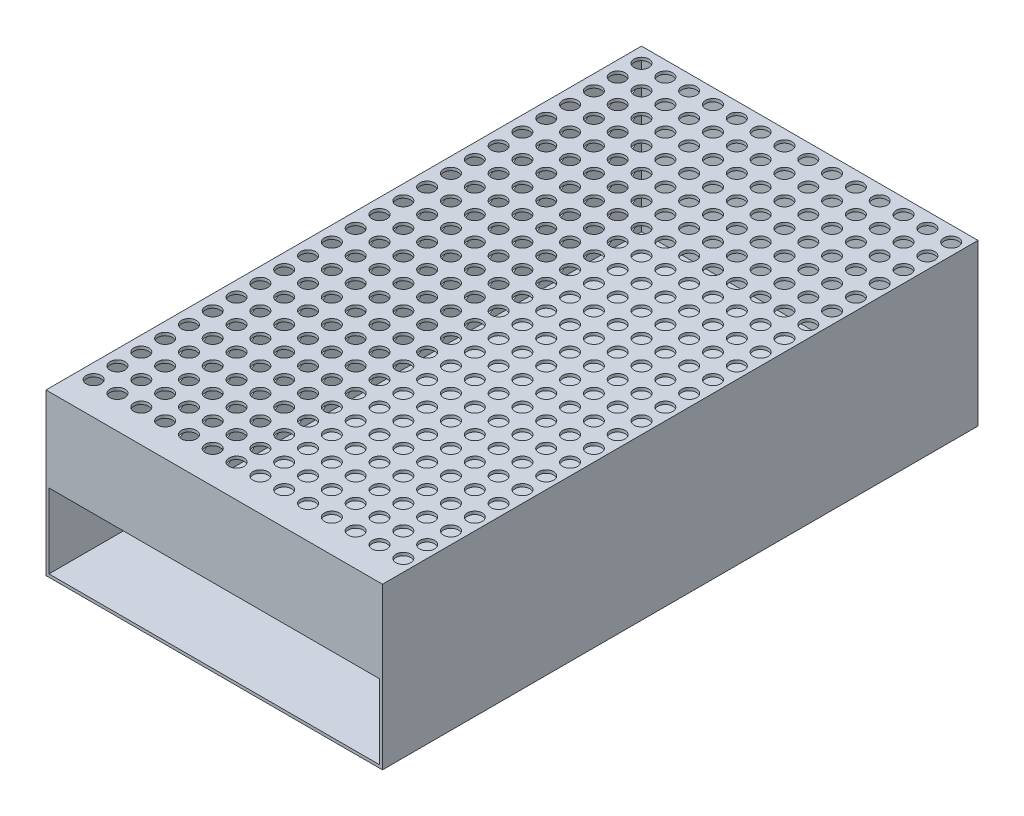
from build123d import *

# Parameters (mm, degrees)
SKETCH1_W           = 113
SKETCH1_H           = 200
BOSS_EXTRUDE1_DEPTH = 54
SKETCH3_W           = 111
SKETCH3_H           = 52
CUT_EXTRUDE1_DEPTH  = 199
SKETCH4_R           = 2.5
CUT_EXTRUDE2_DEPTH  = 65
SKETCH5_R           = 2.5
CUT_EXTRUDE3_DEPTH  = 37
SKETCH6_W           = 113
SKETCH6_H           = 1
BOSS_EXTRUDE2_DEPTH = 27


with BuildPart() as part:
    # Sketch1 → Boss-Extrude1 (new body)
    with BuildSketch(Plane(origin=(0, 0, 0), x_dir=(1, 0, 0), z_dir=(0, 1, 0))):
        Rectangle(SKETCH1_W, SKETCH1_H)
    extrude(amount=BOSS_EXTRUDE1_DEPTH)

    # Sketch3 → Cut-Extrude1 (cut)
    with BuildSketch(Plane.XY.offset(100)):
        with Locations((0, 27)):
            Rectangle(SKETCH3_W, SKETCH3_H)
    extrude(amount=-CUT_EXTRUDE1_DEPTH, mode=Mode.SUBTRACT)

    # Sketch4 → Cut-Extrude2 (cut)
    with BuildSketch(Plane.ZY.offset(56.5)):
        with Locations((-95, 5)):
            Circle(SKETCH4_R)
        with Locations((-87, 5)):
            Circle(SKETCH4_R)
        with Locations((-79, 5)):
            Circle(SKETCH4_R)
        with Locations((-71, 5)):
            Circle(SKETCH4_R)
        with Locations((-63, 5)):
            Circle(SKETCH4_R)
        with Locations((-55, 5)):
            Circle(SKETCH4_R)
        with Locations((-47, 5)):
            Circle(SKETCH4_R)
        with Locations((-39, 5)):
            Circle(SKETCH4_R)
        with Locations((-31, 5)):
            Circle(SKETCH4_R)
        with Locations((-23, 5)):
            Circle(SKETCH4_R)
        with Locations((-15, 5)):
            Circle(SKETCH4_R)
        with Locations((-7, 5)):
            Circle(SKETCH4_R)
        with Locations((1, 5)):
            Circle(SKETCH4_R)
        with Locations((9, 5)):
            Circle(SKETCH4_R)
        with Locations((17, 5)):
            Circle(SKETCH4_R)
        with Locations((25, 5)):
            Circle(SKETCH4_R)
        with Locations((33, 5)):
            Circle(SKETCH4_R)
        with Locations((41, 5)):
            Circle(SKETCH4_R)
        with Locations((49, 5)):
            Circle(SKETCH4_R)
        with Locations((57, 5)):
            Circle(SKETCH4_R)
        with Locations((-87, 13)):
            Circle(SKETCH4_R)
        with Locations((-79, 13)):
            Circle(SKETCH4_R)
        with Locations((-71, 13)):
            Circle(SKETCH4_R)
        with Locations((-63, 13)):
            Circle(SKETCH4_R)
        with Locations((-55, 13)):
            Circle(SKETCH4_R)
        with Locations((-47, 13)):
            Circle(SKETCH4_R)
        with Locations((-39, 13)):
            Circle(SKETCH4_R)
        with Locations((-31, 13)):
            Circle(SKETCH4_R)
        with Locations((-23, 13)):
            Circle(SKETCH4_R)
        with Locations((-15, 13)):
            Circle(SKETCH4_R)
        with Locations((-7, 13)):
            Circle(SKETCH4_R)
        with Locations((1, 13)):
            Circle(SKETCH4_R)
        with Locations((9, 13)):
            Circle(SKETCH4_R)
        with Locations((17, 13)):
            Circle(SKETCH4_R)
        with Locations((25, 13)):
            Circle(SKETCH4_R)
        with Locations((33, 13)):
            Circle(SKETCH4_R)
        with Locations((41, 13)):
            Circle(SKETCH4_R)
        with Locations((49, 13)):
            Circle(SKETCH4_R)
        with Locations((57, 13)):
            Circle(SKETCH4_R)
        with Locations((-87, 21)):
            Circle(SKETCH4_R)
        with Locations((-79, 21)):
            Circle(SKETCH4_R)
        with Locations((-71, 21)):
            Circle(SKETCH4_R)
        with Locations((-63, 21)):
            Circle(SKETCH4_R)
        with Locations((-55, 21)):
            Circle(SKETCH4_R)
        with Locations((-47, 21)):
            Circle(SKETCH4_R)
        with Locations((-39, 21)):
            Circle(SKETCH4_R)
        with Locations((-31, 21)):
            Circle(SKETCH4_R)
        with Locations((-23, 21)):
            Circle(SKETCH4_R)
        with Locations((-15, 21)):
            Circle(SKETCH4_R)
        with Locations((-7, 21)):
            Circle(SKETCH4_R)
        with Locations((1, 21)):
            Circle(SKETCH4_R)
        with Locations((9, 21)):
            Circle(SKETCH4_R)
        with Locations((17, 21)):
            Circle(SKETCH4_R)
        with Locations((25, 21)):
            Circle(SKETCH4_R)
        with Locations((33, 21)):
            Circle(SKETCH4_R)
        with Locations((41, 21)):
            Circle(SKETCH4_R)
        with Locations((49, 21)):
            Circle(SKETCH4_R)
        with Locations((57, 21)):
            Circle(SKETCH4_R)
        with Locations((-87, 29)):
            Circle(SKETCH4_R)
        with Locations((-79, 29)):
            Circle(SKETCH4_R)
        with Locations((-71, 29)):
            Circle(SKETCH4_R)
        with Locations((-63, 29)):
            Circle(SKETCH4_R)
        with Locations((-55, 29)):
            Circle(SKETCH4_R)
        with Locations((-47, 29)):
            Circle(SKETCH4_R)
        with Locations((-39, 29)):
            Circle(SKETCH4_R)
        with Locations((-31, 29)):
            Circle(SKETCH4_R)
        with Locations((-23, 29)):
            Circle(SKETCH4_R)
        with Locations((-15, 29)):
            Circle(SKETCH4_R)
        with Locations((-7, 29)):
            Circle(SKETCH4_R)
        with Locations((1, 29)):
            Circle(SKETCH4_R)
        with Locations((9, 29)):
            Circle(SKETCH4_R)
        with Locations((17, 29)):
            Circle(SKETCH4_R)
        with Locations((25, 29)):
            Circle(SKETCH4_R)
        with Locations((33, 29)):
            Circle(SKETCH4_R)
        with Locations((41, 29)):
            Circle(SKETCH4_R)
        with Locations((49, 29)):
            Circle(SKETCH4_R)
        with Locations((57, 29)):
            Circle(SKETCH4_R)
        with Locations((-87, 37)):
            Circle(SKETCH4_R)
        with Locations((-79, 37)):
            Circle(SKETCH4_R)
        with Locations((-71, 37)):
            Circle(SKETCH4_R)
        with Locations((-63, 37)):
            Circle(SKETCH4_R)
        with Locations((-55, 37)):
            Circle(SKETCH4_R)
        with Locations((-47, 37)):
            Circle(SKETCH4_R)
        with Locations((-39, 37)):
            Circle(SKETCH4_R)
        with Locations((-31, 37)):
            Circle(SKETCH4_R)
        with Locations((-23, 37)):
            Circle(SKETCH4_R)
        with Locations((-15, 37)):
            Circle(SKETCH4_R)
        with Locations((-7, 37)):
            Circle(SKETCH4_R)
        with Locations((1, 37)):
            Circle(SKETCH4_R)
        with Locations((9, 37)):
            Circle(SKETCH4_R)
        with Locations((17, 37)):
            Circle(SKETCH4_R)
        with Locations((25, 37)):
            Circle(SKETCH4_R)
        with Locations((33, 37)):
            Circle(SKETCH4_R)
        with Locations((41, 37)):
            Circle(SKETCH4_R)
        with Locations((49, 37)):
            Circle(SKETCH4_R)
        with Locations((57, 37)):
            Circle(SKETCH4_R)
        with Locations((-87, 45)):
            Circle(SKETCH4_R)
        with Locations((-79, 45)):
            Circle(SKETCH4_R)
        with Locations((-71, 45)):
            Circle(SKETCH4_R)
        with Locations((-63, 45)):
            Circle(SKETCH4_R)
        with Locations((-55, 45)):
            Circle(SKETCH4_R)
        with Locations((-47, 45)):
            Circle(SKETCH4_R)
        with Locations((-39, 45)):
            Circle(SKETCH4_R)
        with Locations((-31, 45)):
            Circle(SKETCH4_R)
        with Locations((-23, 45)):
            Circle(SKETCH4_R)
        with Locations((-15, 45)):
            Circle(SKETCH4_R)
        with Locations((-7, 45)):
            Circle(SKETCH4_R)
        with Locations((1, 45)):
            Circle(SKETCH4_R)
        with Locations((9, 45)):
            Circle(SKETCH4_R)
        with Locations((17, 45)):
            Circle(SKETCH4_R)
        with Locations((25, 45)):
            Circle(SKETCH4_R)
        with Locations((33, 45)):
            Circle(SKETCH4_R)
        with Locations((41, 45)):
            Circle(SKETCH4_R)
        with Locations((49, 45)):
            Circle(SKETCH4_R)
        with Locations((57, 45)):
            Circle(SKETCH4_R)
        with Locations((-95, 13)):
            Circle(SKETCH4_R)
        with Locations((-95, 21)):
            Circle(SKETCH4_R)
        with Locations((-95, 29)):
            Circle(SKETCH4_R)
        with Locations((-95, 37)):
            Circle(SKETCH4_R)
        with Locations((-95, 45)):
            Circle(SKETCH4_R)
    extrude(amount=-CUT_EXTRUDE2_DEPTH, mode=Mode.SUBTRACT)

    # Sketch5 → Cut-Extrude3 (cut)
    with BuildSketch(Plane(origin=(0, 54, 0), x_dir=(1, 0, 0), z_dir=(0, 1, 0))):
        with Locations(Location((-51.5, 95, 0), (0, 0, 270))):
            Circle(SKETCH5_R)
        with Locations(Location((-43.5, 95, 0), (0, 0, 270))):
            Circle(SKETCH5_R)
        with Locations(Location((-35.5, 95, 0), (0, 0, 270))):
            Circle(SKETCH5_R)
        with Locations(Location((-27.5, 95, 0), (0, 0, 270))):
            Circle(SKETCH5_R)
        with Locations(Location((-19.5, 95, 0), (0, 0, 270))):
            Circle(SKETCH5_R)
        with Locations(Location((-11.5, 95, 0), (0, 0, 270))):
            Circle(SKETCH5_R)
        with Locations(Location((-3.5, 95, 0), (0, 0, 270))):
            Circle(SKETCH5_R)
        with Locations(Location((4.5, 95, 0), (0, 0, 270))):
            Circle(SKETCH5_R)
        with Locations(Location((12.5, 95, 0), (0, 0, 270))):
            Circle(SKETCH5_R)
        with Locations(Location((20.5, 95, 0), (0, 0, 270))):
            Circle(SKETCH5_R)
        with Locations(Location((28.5, 95, 0), (0, 0, 270))):
            Circle(SKETCH5_R)
        with Locations(Location((36.5, 95, 0), (0, 0, 270))):
            Circle(SKETCH5_R)
        with Locations(Location((44.5, 95, 0), (0, 0, 270))):
            Circle(SKETCH5_R)
        with Locations(Location((52.5, 95, 0), (0, 0, 270))):
            Circle(SKETCH5_R)
        with Locations(Location((-43.5, 87, 0), (0, 0, 270))):
            Circle(SKETCH5_R)
        with Locations(Location((-35.5, 87, 0), (0, 0, 270))):
            Circle(SKETCH5_R)
        with Locations(Location((-27.5, 87, 0), (0, 0, 270))):
            Circle(SKETCH5_R)
        with Locations(Location((-19.5, 87, 0), (0, 0, 270))):
            Circle(SKETCH5_R)
        with Locations(Location((-11.5, 87, 0), (0, 0, 270))):
            Circle(SKETCH5_R)
        with Locations(Location((-3.5, 87, 0), (0, 0, 270))):
            Circle(SKETCH5_R)
        with Locations(Location((4.5, 87, 0), (0, 0, 270))):
            Circle(SKETCH5_R)
        with Locations(Location((12.5, 87, 0), (0, 0, 270))):
            Circle(SKETCH5_R)
        with Locations(Location((20.5, 87, 0), (0, 0, 270))):
            Circle(SKETCH5_R)
        with Locations(Location((28.5, 87, 0), (0, 0, 270))):
            Circle(SKETCH5_R)
        with Locations(Location((36.5, 87, 0), (0, 0, 270))):
            Circle(SKETCH5_R)
        with Locations(Location((44.5, 87, 0), (0, 0, 270))):
            Circle(SKETCH5_R)
        with Locations(Location((52.5, 87, 0), (0, 0, 270))):
            Circle(SKETCH5_R)
        with Locations(Location((-43.5, 79, 0), (0, 0, 270))):
            Circle(SKETCH5_R)
        with Locations(Location((-35.5, 79, 0), (0, 0, 270))):
            Circle(SKETCH5_R)
        with Locations(Location((-27.5, 79, 0), (0, 0, 270))):
            Circle(SKETCH5_R)
        with Locations(Location((-19.5, 79, 0), (0, 0, 270))):
            Circle(SKETCH5_R)
        with Locations(Location((-11.5, 79, 0), (0, 0, 270))):
            Circle(SKETCH5_R)
        with Locations(Location((-3.5, 79, 0), (0, 0, 270))):
            Circle(SKETCH5_R)
        with Locations(Location((4.5, 79, 0), (0, 0, 270))):
            Circle(SKETCH5_R)
        with Locations(Location((12.5, 79, 0), (0, 0, 270))):
            Circle(SKETCH5_R)
        with Locations(Location((20.5, 79, 0), (0, 0, 270))):
            Circle(SKETCH5_R)
        with Locations(Location((28.5, 79, 0), (0, 0, 270))):
            Circle(SKETCH5_R)
        with Locations(Location((36.5, 79, 0), (0, 0, 270))):
            Circle(SKETCH5_R)
        with Locations(Location((44.5, 79, 0), (0, 0, 270))):
            Circle(SKETCH5_R)
        with Locations(Location((52.5, 79, 0), (0, 0, 270))):
            Circle(SKETCH5_R)
        with Locations(Location((-43.5, 71, 0), (0, 0, 270))):
            Circle(SKETCH5_R)
        with Locations(Location((-35.5, 71, 0), (0, 0, 270))):
            Circle(SKETCH5_R)
        with Locations(Location((-27.5, 71, 0), (0, 0, 270))):
            Circle(SKETCH5_R)
        with Locations(Location((-19.5, 71, 0), (0, 0, 270))):
            Circle(SKETCH5_R)
        with Locations(Location((-11.5, 71, 0), (0, 0, 270))):
            Circle(SKETCH5_R)
        with Locations(Location((-3.5, 71, 0), (0, 0, 270))):
            Circle(SKETCH5_R)
        with Locations(Location((4.5, 71, 0), (0, 0, 270))):
            Circle(SKETCH5_R)
        with Locations(Location((12.5, 71, 0), (0, 0, 270))):
            Circle(SKETCH5_R)
        with Locations(Location((20.5, 71, 0), (0, 0, 270))):
            Circle(SKETCH5_R)
        with Locations(Location((28.5, 71, 0), (0, 0, 270))):
            Circle(SKETCH5_R)
        with Locations(Location((36.5, 71, 0), (0, 0, 270))):
            Circle(SKETCH5_R)
        with Locations(Location((44.5, 71, 0), (0, 0, 270))):
            Circle(SKETCH5_R)
        with Locations(Location((52.5, 71, 0), (0, 0, 270))):
            Circle(SKETCH5_R)
        with Locations(Location((-43.5, 63, 0), (0, 0, 270))):
            Circle(SKETCH5_R)
        with Locations(Location((-35.5, 63, 0), (0, 0, 270))):
            Circle(SKETCH5_R)
        with Locations(Location((-27.5, 63, 0), (0, 0, 270))):
            Circle(SKETCH5_R)
        with Locations(Location((-19.5, 63, 0), (0, 0, 270))):
            Circle(SKETCH5_R)
        with Locations(Location((-11.5, 63, 0), (0, 0, 270))):
            Circle(SKETCH5_R)
        with Locations(Location((-3.5, 63, 0), (0, 0, 270))):
            Circle(SKETCH5_R)
        with Locations(Location((4.5, 63, 0), (0, 0, 270))):
            Circle(SKETCH5_R)
        with Locations(Location((12.5, 63, 0), (0, 0, 270))):
            Circle(SKETCH5_R)
        with Locations(Location((20.5, 63, 0), (0, 0, 270))):
            Circle(SKETCH5_R)
        with Locations(Location((28.5, 63, 0), (0, 0, 270))):
            Circle(SKETCH5_R)
        with Locations(Location((36.5, 63, 0), (0, 0, 270))):
            Circle(SKETCH5_R)
        with Locations(Location((44.5, 63, 0), (0, 0, 270))):
            Circle(SKETCH5_R)
        with Locations(Location((52.5, 63, 0), (0, 0, 270))):
            Circle(SKETCH5_R)
        with Locations(Location((-43.5, 55, 0), (0, 0, 270))):
            Circle(SKETCH5_R)
        with Locations(Location((-35.5, 55, 0), (0, 0, 270))):
            Circle(SKETCH5_R)
        with Locations(Location((-27.5, 55, 0), (0, 0, 270))):
            Circle(SKETCH5_R)
        with Locations(Location((-19.5, 55, 0), (0, 0, 270))):
            Circle(SKETCH5_R)
        with Locations(Location((-11.5, 55, 0), (0, 0, 270))):
            Circle(SKETCH5_R)
        with Locations(Location((-3.5, 55, 0), (0, 0, 270))):
            Circle(SKETCH5_R)
        with Locations(Location((4.5, 55, 0), (0, 0, 270))):
            Circle(SKETCH5_R)
        with Locations(Location((12.5, 55, 0), (0, 0, 270))):
            Circle(SKETCH5_R)
        with Locations(Location((20.5, 55, 0), (0, 0, 270))):
            Circle(SKETCH5_R)
        with Locations(Location((28.5, 55, 0), (0, 0, 270))):
            Circle(SKETCH5_R)
        with Locations(Location((36.5, 55, 0), (0, 0, 270))):
            Circle(SKETCH5_R)
        with Locations(Location((44.5, 55, 0), (0, 0, 270))):
            Circle(SKETCH5_R)
        with Locations(Location((52.5, 55, 0), (0, 0, 270))):
            Circle(SKETCH5_R)
        with Locations(Location((-43.5, 47, 0), (0, 0, 270))):
            Circle(SKETCH5_R)
        with Locations(Location((-35.5, 47, 0), (0, 0, 270))):
            Circle(SKETCH5_R)
        with Locations(Location((-27.5, 47, 0), (0, 0, 270))):
            Circle(SKETCH5_R)
        with Locations(Location((-19.5, 47, 0), (0, 0, 270))):
            Circle(SKETCH5_R)
        with Locations(Location((-11.5, 47, 0), (0, 0, 270))):
            Circle(SKETCH5_R)
        with Locations(Location((-3.5, 47, 0), (0, 0, 270))):
            Circle(SKETCH5_R)
        with Locations(Location((4.5, 47, 0), (0, 0, 270))):
            Circle(SKETCH5_R)
        with Locations(Location((12.5, 47, 0), (0, 0, 270))):
            Circle(SKETCH5_R)
        with Locations(Location((20.5, 47, 0), (0, 0, 270))):
            Circle(SKETCH5_R)
        with Locations(Location((28.5, 47, 0), (0, 0, 270))):
            Circle(SKETCH5_R)
        with Locations(Location((36.5, 47, 0), (0, 0, 270))):
            Circle(SKETCH5_R)
        with Locations(Location((44.5, 47, 0), (0, 0, 270))):
            Circle(SKETCH5_R)
        with Locations(Location((52.5, 47, 0), (0, 0, 270))):
            Circle(SKETCH5_R)
        with Locations(Location((-43.5, 39, 0), (0, 0, 270))):
            Circle(SKETCH5_R)
        with Locations(Location((-35.5, 39, 0), (0, 0, 270))):
            Circle(SKETCH5_R)
        with Locations(Location((-27.5, 39, 0), (0, 0, 270))):
            Circle(SKETCH5_R)
        with Locations(Location((-19.5, 39, 0), (0, 0, 270))):
            Circle(SKETCH5_R)
        with Locations(Location((-11.5, 39, 0), (0, 0, 270))):
            Circle(SKETCH5_R)
        with Locations(Location((-3.5, 39, 0), (0, 0, 270))):
            Circle(SKETCH5_R)
        with Locations(Location((4.5, 39, 0), (0, 0, 270))):
            Circle(SKETCH5_R)
        with Locations(Location((12.5, 39, 0), (0, 0, 270))):
            Circle(SKETCH5_R)
        with Locations(Location((20.5, 39, 0), (0, 0, 270))):
            Circle(SKETCH5_R)
        with Locations(Location((28.5, 39, 0), (0, 0, 270))):
            Circle(SKETCH5_R)
        with Locations(Location((36.5, 39, 0), (0, 0, 270))):
            Circle(SKETCH5_R)
        with Locations(Location((44.5, 39, 0), (0, 0, 270))):
            Circle(SKETCH5_R)
        with Locations(Location((52.5, 39, 0), (0, 0, 270))):
            Circle(SKETCH5_R)
        with Locations(Location((-43.5, 31, 0), (0, 0, 270))):
            Circle(SKETCH5_R)
        with Locations(Location((-35.5, 31, 0), (0, 0, 270))):
            Circle(SKETCH5_R)
        with Locations(Location((-27.5, 31, 0), (0, 0, 270))):
            Circle(SKETCH5_R)
        with Locations(Location((-19.5, 31, 0), (0, 0, 270))):
            Circle(SKETCH5_R)
        with Locations(Location((-11.5, 31, 0), (0, 0, 270))):
            Circle(SKETCH5_R)
        with Locations(Location((-3.5, 31, 0), (0, 0, 270))):
            Circle(SKETCH5_R)
        with Locations(Location((4.5, 31, 0), (0, 0, 270))):
            Circle(SKETCH5_R)
        with Locations(Location((12.5, 31, 0), (0, 0, 270))):
            Circle(SKETCH5_R)
        with Locations(Location((20.5, 31, 0), (0, 0, 270))):
            Circle(SKETCH5_R)
        with Locations(Location((28.5, 31, 0), (0, 0, 270))):
            Circle(SKETCH5_R)
        with Locations(Location((36.5, 31, 0), (0, 0, 270))):
            Circle(SKETCH5_R)
        with Locations(Location((44.5, 31, 0), (0, 0, 270))):
            Circle(SKETCH5_R)
        with Locations(Location((52.5, 31, 0), (0, 0, 270))):
            Circle(SKETCH5_R)
        with Locations(Location((-43.5, 23, 0), (0, 0, 270))):
            Circle(SKETCH5_R)
        with Locations(Location((-35.5, 23, 0), (0, 0, 270))):
            Circle(SKETCH5_R)
        with Locations(Location((-27.5, 23, 0), (0, 0, 270))):
            Circle(SKETCH5_R)
        with Locations(Location((-19.5, 23, 0), (0, 0, 270))):
            Circle(SKETCH5_R)
        with Locations(Location((-11.5, 23, 0), (0, 0, 270))):
            Circle(SKETCH5_R)
        with Locations(Location((-3.5, 23, 0), (0, 0, 270))):
            Circle(SKETCH5_R)
        with Locations(Location((4.5, 23, 0), (0, 0, 270))):
            Circle(SKETCH5_R)
        with Locations(Location((12.5, 23, 0), (0, 0, 270))):
            Circle(SKETCH5_R)
        with Locations(Location((20.5, 23, 0), (0, 0, 270))):
            Circle(SKETCH5_R)
        with Locations(Location((28.5, 23, 0), (0, 0, 270))):
            Circle(SKETCH5_R)
        with Locations(Location((36.5, 23, 0), (0, 0, 270))):
            Circle(SKETCH5_R)
        with Locations(Location((44.5, 23, 0), (0, 0, 270))):
            Circle(SKETCH5_R)
        with Locations(Location((52.5, 23, 0), (0, 0, 270))):
            Circle(SKETCH5_R)
        with Locations(Location((-43.5, 15, 0), (0, 0, 270))):
            Circle(SKETCH5_R)
        with Locations(Location((-35.5, 15, 0), (0, 0, 270))):
            Circle(SKETCH5_R)
        with Locations(Location((-27.5, 15, 0), (0, 0, 270))):
            Circle(SKETCH5_R)
        with Locations(Location((-19.5, 15, 0), (0, 0, 270))):
            Circle(SKETCH5_R)
        with Locations(Location((-11.5, 15, 0), (0, 0, 270))):
            Circle(SKETCH5_R)
        with Locations(Location((-3.5, 15, 0), (0, 0, 270))):
            Circle(SKETCH5_R)
        with Locations(Location((4.5, 15, 0), (0, 0, 270))):
            Circle(SKETCH5_R)
        with Locations(Location((12.5, 15, 0), (0, 0, 270))):
            Circle(SKETCH5_R)
        with Locations(Location((20.5, 15, 0), (0, 0, 270))):
            Circle(SKETCH5_R)
        with Locations(Location((28.5, 15, 0), (0, 0, 270))):
            Circle(SKETCH5_R)
        with Locations(Location((36.5, 15, 0), (0, 0, 270))):
            Circle(SKETCH5_R)
        with Locations(Location((44.5, 15, 0), (0, 0, 270))):
            Circle(SKETCH5_R)
        with Locations(Location((52.5, 15, 0), (0, 0, 270))):
            Circle(SKETCH5_R)
        with Locations(Location((-43.5, 7, 0), (0, 0, 270))):
            Circle(SKETCH5_R)
        with Locations(Location((-35.5, 7, 0), (0, 0, 270))):
            Circle(SKETCH5_R)
        with Locations(Location((-27.5, 7, 0), (0, 0, 270))):
            Circle(SKETCH5_R)
        with Locations(Location((-19.5, 7, 0), (0, 0, 270))):
            Circle(SKETCH5_R)
        with Locations(Location((-11.5, 7, 0), (0, 0, 270))):
            Circle(SKETCH5_R)
        with Locations(Location((-3.5, 7, 0), (0, 0, 270))):
            Circle(SKETCH5_R)
        with Locations(Location((4.5, 7, 0), (0, 0, 270))):
            Circle(SKETCH5_R)
        with Locations(Location((12.5, 7, 0), (0, 0, 270))):
            Circle(SKETCH5_R)
        with Locations(Location((20.5, 7, 0), (0, 0, 270))):
            Circle(SKETCH5_R)
        with Locations(Location((28.5, 7, 0), (0, 0, 270))):
            Circle(SKETCH5_R)
        with Locations(Location((36.5, 7, 0), (0, 0, 270))):
            Circle(SKETCH5_R)
        with Locations(Location((44.5, 7, 0), (0, 0, 270))):
            Circle(SKETCH5_R)
        with Locations(Location((52.5, 7, 0), (0, 0, 270))):
            Circle(SKETCH5_R)
        with Locations(Location((-43.5, -1, 0), (0, 0, 270))):
            Circle(SKETCH5_R)
        with Locations(Location((-35.5, -1, 0), (0, 0, 270))):
            Circle(SKETCH5_R)
        with Locations(Location((-27.5, -1, 0), (0, 0, 270))):
            Circle(SKETCH5_R)
        with Locations(Location((-19.5, -1, 0), (0, 0, 270))):
            Circle(SKETCH5_R)
        with Locations(Location((-11.5, -1, 0), (0, 0, 270))):
            Circle(SKETCH5_R)
        with Locations(Location((-3.5, -1, 0), (0, 0, 270))):
            Circle(SKETCH5_R)
        with Locations(Location((4.5, -1, 0), (0, 0, 270))):
            Circle(SKETCH5_R)
        with Locations(Location((12.5, -1, 0), (0, 0, 270))):
            Circle(SKETCH5_R)
        with Locations(Location((20.5, -1, 0), (0, 0, 270))):
            Circle(SKETCH5_R)
        with Locations(Location((28.5, -1, 0), (0, 0, 270))):
            Circle(SKETCH5_R)
        with Locations(Location((36.5, -1, 0), (0, 0, 270))):
            Circle(SKETCH5_R)
        with Locations(Location((44.5, -1, 0), (0, 0, 270))):
            Circle(SKETCH5_R)
        with Locations(Location((52.5, -1, 0), (0, 0, 270))):
            Circle(SKETCH5_R)
        with Locations(Location((-43.5, -9, 0), (0, 0, 270))):
            Circle(SKETCH5_R)
        with Locations(Location((-35.5, -9, 0), (0, 0, 270))):
            Circle(SKETCH5_R)
        with Locations(Location((-27.5, -9, 0), (0, 0, 270))):
            Circle(SKETCH5_R)
        with Locations(Location((-19.5, -9, 0), (0, 0, 270))):
            Circle(SKETCH5_R)
        with Locations(Location((-11.5, -9, 0), (0, 0, 270))):
            Circle(SKETCH5_R)
        with Locations(Location((-3.5, -9, 0), (0, 0, 270))):
            Circle(SKETCH5_R)
        with Locations(Location((4.5, -9, 0), (0, 0, 270))):
            Circle(SKETCH5_R)
        with Locations(Location((12.5, -9, 0), (0, 0, 270))):
            Circle(SKETCH5_R)
        with Locations(Location((20.5, -9, 0), (0, 0, 270))):
            Circle(SKETCH5_R)
        with Locations(Location((28.5, -9, 0), (0, 0, 270))):
            Circle(SKETCH5_R)
        with Locations(Location((36.5, -9, 0), (0, 0, 270))):
            Circle(SKETCH5_R)
        with Locations(Location((44.5, -9, 0), (0, 0, 270))):
            Circle(SKETCH5_R)
        with Locations(Location((52.5, -9, 0), (0, 0, 270))):
            Circle(SKETCH5_R)
        with Locations(Location((-43.5, -17, 0), (0, 0, 270))):
            Circle(SKETCH5_R)
        with Locations(Location((-35.5, -17, 0), (0, 0, 270))):
            Circle(SKETCH5_R)
        with Locations(Location((-27.5, -17, 0), (0, 0, 270))):
            Circle(SKETCH5_R)
        with Locations(Location((-19.5, -17, 0), (0, 0, 270))):
            Circle(SKETCH5_R)
        with Locations(Location((-11.5, -17, 0), (0, 0, 270))):
            Circle(SKETCH5_R)
        with Locations(Location((-3.5, -17, 0), (0, 0, 270))):
            Circle(SKETCH5_R)
        with Locations(Location((4.5, -17, 0), (0, 0, 270))):
            Circle(SKETCH5_R)
        with Locations(Location((12.5, -17, 0), (0, 0, 270))):
            Circle(SKETCH5_R)
        with Locations(Location((20.5, -17, 0), (0, 0, 270))):
            Circle(SKETCH5_R)
        with Locations(Location((28.5, -17, 0), (0, 0, 270))):
            Circle(SKETCH5_R)
        with Locations(Location((36.5, -17, 0), (0, 0, 270))):
            Circle(SKETCH5_R)
        with Locations(Location((44.5, -17, 0), (0, 0, 270))):
            Circle(SKETCH5_R)
        with Locations(Location((52.5, -17, 0), (0, 0, 270))):
            Circle(SKETCH5_R)
        with Locations(Location((-43.5, -25, 0), (0, 0, 270))):
            Circle(SKETCH5_R)
        with Locations(Location((-35.5, -25, 0), (0, 0, 270))):
            Circle(SKETCH5_R)
        with Locations(Location((-27.5, -25, 0), (0, 0, 270))):
            Circle(SKETCH5_R)
        with Locations(Location((-19.5, -25, 0), (0, 0, 270))):
            Circle(SKETCH5_R)
        with Locations(Location((-11.5, -25, 0), (0, 0, 270))):
            Circle(SKETCH5_R)
        with Locations(Location((-3.5, -25, 0), (0, 0, 270))):
            Circle(SKETCH5_R)
        with Locations(Location((4.5, -25, 0), (0, 0, 270))):
            Circle(SKETCH5_R)
        with Locations(Location((12.5, -25, 0), (0, 0, 270))):
            Circle(SKETCH5_R)
        with Locations(Location((20.5, -25, 0), (0, 0, 270))):
            Circle(SKETCH5_R)
        with Locations(Location((28.5, -25, 0), (0, 0, 270))):
            Circle(SKETCH5_R)
        with Locations(Location((36.5, -25, 0), (0, 0, 270))):
            Circle(SKETCH5_R)
        with Locations(Location((44.5, -25, 0), (0, 0, 270))):
            Circle(SKETCH5_R)
        with Locations(Location((52.5, -25, 0), (0, 0, 270))):
            Circle(SKETCH5_R)
        with Locations(Location((-43.5, -33, 0), (0, 0, 270))):
            Circle(SKETCH5_R)
        with Locations(Location((-35.5, -33, 0), (0, 0, 270))):
            Circle(SKETCH5_R)
        with Locations(Location((-27.5, -33, 0), (0, 0, 270))):
            Circle(SKETCH5_R)
        with Locations(Location((-19.5, -33, 0), (0, 0, 270))):
            Circle(SKETCH5_R)
        with Locations(Location((-11.5, -33, 0), (0, 0, 270))):
            Circle(SKETCH5_R)
        with Locations(Location((-3.5, -33, 0), (0, 0, 270))):
            Circle(SKETCH5_R)
        with Locations(Location((4.5, -33, 0), (0, 0, 270))):
            Circle(SKETCH5_R)
        with Locations(Location((12.5, -33, 0), (0, 0, 270))):
            Circle(SKETCH5_R)
        with Locations(Location((20.5, -33, 0), (0, 0, 270))):
            Circle(SKETCH5_R)
        with Locations(Location((28.5, -33, 0), (0, 0, 270))):
            Circle(SKETCH5_R)
        with Locations(Location((36.5, -33, 0), (0, 0, 270))):
            Circle(SKETCH5_R)
        with Locations(Location((44.5, -33, 0), (0, 0, 270))):
            Circle(SKETCH5_R)
        with Locations(Location((52.5, -33, 0), (0, 0, 270))):
            Circle(SKETCH5_R)
        with Locations(Location((-43.5, -41, 0), (0, 0, 270))):
            Circle(SKETCH5_R)
        with Locations(Location((-35.5, -41, 0), (0, 0, 270))):
            Circle(SKETCH5_R)
        with Locations(Location((-27.5, -41, 0), (0, 0, 270))):
            Circle(SKETCH5_R)
        with Locations(Location((-19.5, -41, 0), (0, 0, 270))):
            Circle(SKETCH5_R)
        with Locations(Location((-11.5, -41, 0), (0, 0, 270))):
            Circle(SKETCH5_R)
        with Locations(Location((-3.5, -41, 0), (0, 0, 270))):
            Circle(SKETCH5_R)
        with Locations(Location((4.5, -41, 0), (0, 0, 270))):
            Circle(SKETCH5_R)
        with Locations(Location((12.5, -41, 0), (0, 0, 270))):
            Circle(SKETCH5_R)
        with Locations(Location((20.5, -41, 0), (0, 0, 270))):
            Circle(SKETCH5_R)
        with Locations(Location((28.5, -41, 0), (0, 0, 270))):
            Circle(SKETCH5_R)
        with Locations(Location((36.5, -41, 0), (0, 0, 270))):
            Circle(SKETCH5_R)
        with Locations(Location((44.5, -41, 0), (0, 0, 270))):
            Circle(SKETCH5_R)
        with Locations(Location((52.5, -41, 0), (0, 0, 270))):
            Circle(SKETCH5_R)
        with Locations(Location((-43.5, -49, 0), (0, 0, 270))):
            Circle(SKETCH5_R)
        with Locations(Location((-35.5, -49, 0), (0, 0, 270))):
            Circle(SKETCH5_R)
        with Locations(Location((-27.5, -49, 0), (0, 0, 270))):
            Circle(SKETCH5_R)
        with Locations(Location((-19.5, -49, 0), (0, 0, 270))):
            Circle(SKETCH5_R)
        with Locations(Location((-11.5, -49, 0), (0, 0, 270))):
            Circle(SKETCH5_R)
        with Locations(Location((-3.5, -49, 0), (0, 0, 270))):
            Circle(SKETCH5_R)
        with Locations(Location((4.5, -49, 0), (0, 0, 270))):
            Circle(SKETCH5_R)
        with Locations(Location((12.5, -49, 0), (0, 0, 270))):
            Circle(SKETCH5_R)
        with Locations(Location((20.5, -49, 0), (0, 0, 270))):
            Circle(SKETCH5_R)
        with Locations(Location((28.5, -49, 0), (0, 0, 270))):
            Circle(SKETCH5_R)
        with Locations(Location((36.5, -49, 0), (0, 0, 270))):
            Circle(SKETCH5_R)
        with Locations(Location((44.5, -49, 0), (0, 0, 270))):
            Circle(SKETCH5_R)
        with Locations(Location((52.5, -49, 0), (0, 0, 270))):
            Circle(SKETCH5_R)
        with Locations(Location((-43.5, -57, 0), (0, 0, 270))):
            Circle(SKETCH5_R)
        with Locations(Location((-35.5, -57, 0), (0, 0, 270))):
            Circle(SKETCH5_R)
        with Locations(Location((-27.5, -57, 0), (0, 0, 270))):
            Circle(SKETCH5_R)
        with Locations(Location((-19.5, -57, 0), (0, 0, 270))):
            Circle(SKETCH5_R)
        with Locations(Location((-11.5, -57, 0), (0, 0, 270))):
            Circle(SKETCH5_R)
        with Locations(Location((-3.5, -57, 0), (0, 0, 270))):
            Circle(SKETCH5_R)
        with Locations(Location((4.5, -57, 0), (0, 0, 270))):
            Circle(SKETCH5_R)
        with Locations(Location((12.5, -57, 0), (0, 0, 270))):
            Circle(SKETCH5_R)
        with Locations(Location((20.5, -57, 0), (0, 0, 270))):
            Circle(SKETCH5_R)
        with Locations(Location((28.5, -57, 0), (0, 0, 270))):
            Circle(SKETCH5_R)
        with Locations(Location((36.5, -57, 0), (0, 0, 270))):
            Circle(SKETCH5_R)
        with Locations(Location((44.5, -57, 0), (0, 0, 270))):
            Circle(SKETCH5_R)
        with Locations(Location((52.5, -57, 0), (0, 0, 270))):
            Circle(SKETCH5_R)
        with Locations(Location((-43.5, -65, 0), (0, 0, 270))):
            Circle(SKETCH5_R)
        with Locations(Location((-35.5, -65, 0), (0, 0, 270))):
            Circle(SKETCH5_R)
        with Locations(Location((-27.5, -65, 0), (0, 0, 270))):
            Circle(SKETCH5_R)
        with Locations(Location((-19.5, -65, 0), (0, 0, 270))):
            Circle(SKETCH5_R)
        with Locations(Location((-11.5, -65, 0), (0, 0, 270))):
            Circle(SKETCH5_R)
        with Locations(Location((-3.5, -65, 0), (0, 0, 270))):
            Circle(SKETCH5_R)
        with Locations(Location((4.5, -65, 0), (0, 0, 270))):
            Circle(SKETCH5_R)
        with Locations(Location((12.5, -65, 0), (0, 0, 270))):
            Circle(SKETCH5_R)
        with Locations(Location((20.5, -65, 0), (0, 0, 270))):
            Circle(SKETCH5_R)
        with Locations(Location((28.5, -65, 0), (0, 0, 270))):
            Circle(SKETCH5_R)
        with Locations(Location((36.5, -65, 0), (0, 0, 270))):
            Circle(SKETCH5_R)
        with Locations(Location((44.5, -65, 0), (0, 0, 270))):
            Circle(SKETCH5_R)
        with Locations(Location((52.5, -65, 0), (0, 0, 270))):
            Circle(SKETCH5_R)
        with Locations(Location((-43.5, -73, 0), (0, 0, 270))):
            Circle(SKETCH5_R)
        with Locations(Location((-35.5, -73, 0), (0, 0, 270))):
            Circle(SKETCH5_R)
        with Locations(Location((-27.5, -73, 0), (0, 0, 270))):
            Circle(SKETCH5_R)
        with Locations(Location((-19.5, -73, 0), (0, 0, 270))):
            Circle(SKETCH5_R)
        with Locations(Location((-11.5, -73, 0), (0, 0, 270))):
            Circle(SKETCH5_R)
        with Locations(Location((-3.5, -73, 0), (0, 0, 270))):
            Circle(SKETCH5_R)
        with Locations(Location((4.5, -73, 0), (0, 0, 270))):
            Circle(SKETCH5_R)
        with Locations(Location((12.5, -73, 0), (0, 0, 270))):
            Circle(SKETCH5_R)
        with Locations(Location((20.5, -73, 0), (0, 0, 270))):
            Circle(SKETCH5_R)
        with Locations(Location((28.5, -73, 0), (0, 0, 270))):
            Circle(SKETCH5_R)
        with Locations(Location((36.5, -73, 0), (0, 0, 270))):
            Circle(SKETCH5_R)
        with Locations(Location((44.5, -73, 0), (0, 0, 270))):
            Circle(SKETCH5_R)
        with Locations(Location((52.5, -73, 0), (0, 0, 270))):
            Circle(SKETCH5_R)
        with Locations(Location((-43.5, -81, 0), (0, 0, 270))):
            Circle(SKETCH5_R)
        with Locations(Location((-35.5, -81, 0), (0, 0, 270))):
            Circle(SKETCH5_R)
        with Locations(Location((-27.5, -81, 0), (0, 0, 270))):
            Circle(SKETCH5_R)
        with Locations(Location((-19.5, -81, 0), (0, 0, 270))):
            Circle(SKETCH5_R)
        with Locations(Location((-11.5, -81, 0), (0, 0, 270))):
            Circle(SKETCH5_R)
        with Locations(Location((-3.5, -81, 0), (0, 0, 270))):
            Circle(SKETCH5_R)
        with Locations(Location((4.5, -81, 0), (0, 0, 270))):
            Circle(SKETCH5_R)
        with Locations(Location((12.5, -81, 0), (0, 0, 270))):
            Circle(SKETCH5_R)
        with Locations(Location((20.5, -81, 0), (0, 0, 270))):
            Circle(SKETCH5_R)
        with Locations(Location((28.5, -81, 0), (0, 0, 270))):
            Circle(SKETCH5_R)
        with Locations(Location((36.5, -81, 0), (0, 0, 270))):
            Circle(SKETCH5_R)
        with Locations(Location((44.5, -81, 0), (0, 0, 270))):
            Circle(SKETCH5_R)
        with Locations(Location((52.5, -81, 0), (0, 0, 270))):
            Circle(SKETCH5_R)
        with Locations(Location((-43.5, -89, 0), (0, 0, 270))):
            Circle(SKETCH5_R)
        with Locations(Location((-35.5, -89, 0), (0, 0, 270))):
            Circle(SKETCH5_R)
        with Locations(Location((-27.5, -89, 0), (0, 0, 270))):
            Circle(SKETCH5_R)
        with Locations(Location((-19.5, -89, 0), (0, 0, 270))):
            Circle(SKETCH5_R)
        with Locations(Location((-11.5, -89, 0), (0, 0, 270))):
            Circle(SKETCH5_R)
        with Locations(Location((-3.5, -89, 0), (0, 0, 270))):
            Circle(SKETCH5_R)
        with Locations(Location((4.5, -89, 0), (0, 0, 270))):
            Circle(SKETCH5_R)
        with Locations(Location((12.5, -89, 0), (0, 0, 270))):
            Circle(SKETCH5_R)
        with Locations(Location((20.5, -89, 0), (0, 0, 270))):
            Circle(SKETCH5_R)
        with Locations(Location((28.5, -89, 0), (0, 0, 270))):
            Circle(SKETCH5_R)
        with Locations(Location((36.5, -89, 0), (0, 0, 270))):
            Circle(SKETCH5_R)
        with Locations(Location((44.5, -89, 0), (0, 0, 270))):
            Circle(SKETCH5_R)
        with Locations(Location((52.5, -89, 0), (0, 0, 270))):
            Circle(SKETCH5_R)
        with Locations(Location((-51.5, 87, 0), (0, 0, 270))):
            Circle(SKETCH5_R)
        with Locations(Location((-51.5, 79, 0), (0, 0, 270))):
            Circle(SKETCH5_R)
        with Locations(Location((-51.5, 71, 0), (0, 0, 270))):
            Circle(SKETCH5_R)
        with Locations(Location((-51.5, 63, 0), (0, 0, 270))):
            Circle(SKETCH5_R)
        with Locations(Location((-51.5, 55, 0), (0, 0, 270))):
            Circle(SKETCH5_R)
        with Locations(Location((-51.5, 47, 0), (0, 0, 270))):
            Circle(SKETCH5_R)
        with Locations(Location((-51.5, 39, 0), (0, 0, 270))):
            Circle(SKETCH5_R)
        with Locations(Location((-51.5, 31, 0), (0, 0, 270))):
            Circle(SKETCH5_R)
        with Locations(Location((-51.5, 23, 0), (0, 0, 270))):
            Circle(SKETCH5_R)
        with Locations(Location((-51.5, 15, 0), (0, 0, 270))):
            Circle(SKETCH5_R)
        with Locations(Location((-51.5, 7, 0), (0, 0, 270))):
            Circle(SKETCH5_R)
        with Locations(Location((-51.5, -1, 0), (0, 0, 270))):
            Circle(SKETCH5_R)
        with Locations(Location((-51.5, -9, 0), (0, 0, 270))):
            Circle(SKETCH5_R)
        with Locations(Location((-51.5, -17, 0), (0, 0, 270))):
            Circle(SKETCH5_R)
        with Locations(Location((-51.5, -25, 0), (0, 0, 270))):
            Circle(SKETCH5_R)
        with Locations(Location((-51.5, -33, 0), (0, 0, 270))):
            Circle(SKETCH5_R)
        with Locations(Location((-51.5, -41, 0), (0, 0, 270))):
            Circle(SKETCH5_R)
        with Locations(Location((-51.5, -49, 0), (0, 0, 270))):
            Circle(SKETCH5_R)
        with Locations(Location((-51.5, -57, 0), (0, 0, 270))):
            Circle(SKETCH5_R)
        with Locations(Location((-51.5, -65, 0), (0, 0, 270))):
            Circle(SKETCH5_R)
        with Locations(Location((-51.5, -73, 0), (0, 0, 270))):
            Circle(SKETCH5_R)
        with Locations(Location((-51.5, -81, 0), (0, 0, 270))):
            Circle(SKETCH5_R)
        with Locations(Location((-51.5, -89, 0), (0, 0, 270))):
            Circle(SKETCH5_R)
    extrude(amount=-CUT_EXTRUDE3_DEPTH, mode=Mode.SUBTRACT)

    # Sketch6 → Boss-Extrude2 (add)
    with BuildSketch(Plane.XZ.offset(-53)):
        with Locations((0, 99.5)):
            Rectangle(SKETCH6_W, SKETCH6_H)
    extrude(amount=BOSS_EXTRUDE2_DEPTH)


solid = part.part
